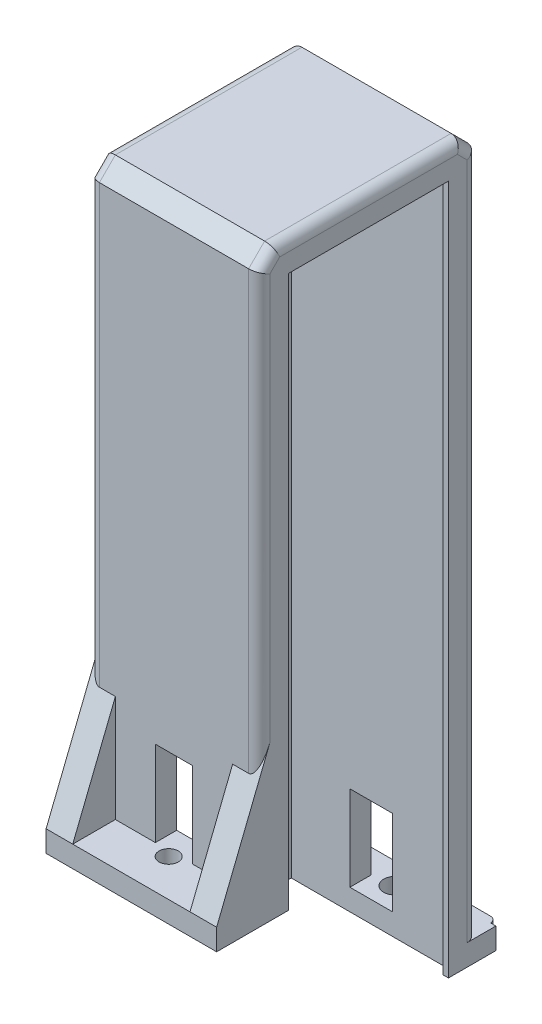
from build123d import *

# Parameters (mm, degrees)
SKETCH1_W            = 30
SKETCH1_H            = 105
BOSS_EXTRUDE1_DEPTH  = 4
SKETCH2_W            = 30
SKETCH2_H            = 12
SKETCH2_R            = 1.8
BOSS_EXTRUDE2_DEPTH  = 4
SKETCH3_W            = 7
SKETCH3_H            = 16
CUT_EXTRUDE1_DEPTH   = 110.494292089
BOSS_EXTRUDE3_DEPTH  = 4
BOSS_EXTRUDE4_START  = -30
BOSS_EXTRUDE4_DEPTH  = 4
SKETCH5_W            = 30
SKETCH5_H            = 41
BOSS_EXTRUDE5_DEPTH  = 4
SKETCH6_W            = 30
SKETCH6_H            = 135
BOSS_EXTRUDE6_DEPTH  = 4
SKETCH7_W            = 30
SKETCH7_H            = 8.5
BOSS_EXTRUDE7_DEPTH  = 4
FILLET1_R            = 1.1
SKETCH10_W           = 2.15
SKETCH10_H           = 4
SKETCH11_W           = 8
SKETCH11_H           = 8.5
CUT_EXTRUDE2_DEPTH   = 16
SKETCH14_W           = 1.8
SKETCH14_H           = 30
BOSS_EXTRUDE8_DEPTH  = 1
SKETCH16_W           = 3.4
SKETCH16_H           = 4
BOSS_EXTRUDE10_DEPTH = 1
BOSS_EXTRUDE9_START  = -30
BOSS_EXTRUDE9_DEPTH  = 1
SKETCH17_W           = 3.4
SKETCH17_H           = 4
BOSS_EXTRUDE11_DEPTH = 1
CHAMFER1_SIZE        = 3
FILLET2_R            = 2


with BuildPart() as part:
    # Sketch1 → Boss-Extrude1 (new body)
    with BuildSketch(Plane.XY):
        with Locations((15, 52.5)):
            Rectangle(SKETCH1_W, SKETCH1_H)
    extrude(amount=BOSS_EXTRUDE1_DEPTH)

    # Sketch2 → Boss-Extrude2 (add)
    with BuildSketch(Plane.XZ):
        with Locations((15, 6)):
            Rectangle(SKETCH2_W, SKETCH2_H)
        with Locations((15, 5)):
            Circle(SKETCH2_R, mode=Mode.SUBTRACT)
    extrude(amount=-BOSS_EXTRUDE2_DEPTH)

    # Sketch3 → Cut-Extrude1 (cut, through all)
    with BuildSketch(Plane.XY.offset(4)):
        with Locations((15, 12)):
            Rectangle(SKETCH3_W, SKETCH3_H)
    extrude(amount=-CUT_EXTRUDE1_DEPTH, mode=Mode.SUBTRACT)

    # Sketch4 → Boss-Extrude3 (add)
    with BuildSketch(Plane.ZY):
        Polygon((12, 4), (0, 34), (0, 4), align=None)
    extrude(amount=-BOSS_EXTRUDE3_DEPTH)

    # Sketch4<2> → Boss-Extrude4 (add)
    with BuildSketch(Plane.ZY.offset(BOSS_EXTRUDE4_START)):
        Polygon((12, 4), (0, 34), (0, 4), align=None)
    extrude(amount=BOSS_EXTRUDE4_DEPTH)

    # Sketch5 → Boss-Extrude5 (add)
    with BuildSketch(Plane(origin=(0, 105, 0), x_dir=(1, 0, 0), z_dir=(0, 1, 0))):
        with Locations((15, 16.5)):
            Rectangle(SKETCH5_W, SKETCH5_H)
    extrude(amount=BOSS_EXTRUDE5_DEPTH)

    # Sketch6 → Boss-Extrude6 (add)
    with BuildSketch(Plane(origin=(0, 0, -37), x_dir=(-1, 0, 0), z_dir=(0, 0, -1))):
        with Locations((-15, 41.5)):
            Rectangle(SKETCH6_W, SKETCH6_H)
    extrude(amount=-BOSS_EXTRUDE6_DEPTH)

    # Sketch7 → Boss-Extrude7 (add)
    with BuildSketch(Plane.XZ.offset(26)):
        with Locations((15, -37.25)):
            Rectangle(SKETCH7_W, SKETCH7_H)
    extrude(amount=-BOSS_EXTRUDE7_DEPTH)

    # Fillet1
    fillet1_edges = [part.edges().sort_by_distance(p)[0] for p in [
        (0, -24, -41.5),
        (30, -24, -41.5),
    ]]
    fillet(fillet1_edges, radius=FILLET1_R)

    # Sketch10 → Ø4.3 (4.3) Diameter Hole1 (revolve, cut)
    with BuildSketch(Plane(origin=(15, -22, -37.5), x_dir=(0, 0, 1), z_dir=(1, 0, 0))):
        with Locations((1.075, 2)):
            Rectangle(SKETCH10_W, SKETCH10_H)
    revolve(axis=Axis((15, -15.65, -37.5), (0, -1, 0)), mode=Mode.SUBTRACT)

    # Sketch11 → Cut-Extrude2 (cut)
    with BuildSketch(Plane(origin=(0, -22, 0), x_dir=(1, 0, 0), z_dir=(0, 1, 0))):
        with Locations((15, 37.25)):
            Rectangle(SKETCH11_W, SKETCH11_H)
    extrude(amount=CUT_EXTRUDE2_DEPTH, mode=Mode.SUBTRACT)

    # Sketch14 → Ø3.6 (3.6) Diameter Hole1 (revolve, cut)
    with BuildSketch(Plane(origin=(15, 4, 5), x_dir=(0, 0, 1), z_dir=(1, 0, 0))):
        with Locations((0.9, 15)):
            Rectangle(SKETCH14_W, SKETCH14_H)
    revolve(axis=Axis((15, 10.35, 5), (0, -1, 0)), mode=Mode.SUBTRACT)

    # Sketch15 → Boss-Extrude8 (add)
    with BuildSketch(Plane.ZY):
        Polygon((-37, 109), (4, 109), (4, 0), (-1.5, 0), (-1.5, 103.5), (-31.5, 103.5), (-31.5, -26), (-37, -26), align=None)
    extrude(amount=BOSS_EXTRUDE8_DEPTH)

    # Sketch16 → Boss-Extrude10 (add)
    with BuildSketch(Plane.ZY):
        Polygon((4, 24), (4, 0), (12, 0), (12, 4), align=None)
        with Locations((-38.7, -24)):
            Rectangle(SKETCH16_W, SKETCH16_H)
    extrude(amount=BOSS_EXTRUDE10_DEPTH)

    # Sketch15<2> → Boss-Extrude9 (add)
    with BuildSketch(Plane.ZY.offset(BOSS_EXTRUDE9_START)):
        Polygon((-37, 109), (4, 109), (4, 0), (-1.5, 0), (-1.5, 103.5), (-31.5, 103.5), (-31.5, -26), (-37, -26), align=None)
    extrude(amount=-BOSS_EXTRUDE9_DEPTH)

    # Sketch17 → Boss-Extrude11 (add)
    with BuildSketch(Plane(origin=(30, 0, 0), x_dir=(0, 0, -1), z_dir=(1, 0, 0))):
        Polygon((-12, 0), (-4, 0), (-4, 24), (-12, 4), align=None)
        with Locations((38.7, -24)):
            Rectangle(SKETCH17_W, SKETCH17_H)
    extrude(amount=BOSS_EXTRUDE11_DEPTH)

    # Chamfer1
    chamfer1_edges = [part.edges().sort_by_distance(p)[0] for p in [
        (15, 109, 4),
        (15, 109, -37),
    ]]
    chamfer(chamfer1_edges, length=CHAMFER1_SIZE)

    # Fillet2
    # the kernel refuses this fillet: 2 mm, written as the material it takes off along each edge
    with BuildSketch(Plane(origin=(-1, 111, 4), x_dir=(1, 0, 0), z_dir=(0, -1, 0))) as fillet2_piece_1_section:
        with BuildLine():
            CenterArc((FILLET2_R, -FILLET2_R), FILLET2_R, 90, 90)
            Line((0, -FILLET2_R), (0, 0))
            Line((0, 0), (FILLET2_R, 0))
        make_face()
    fillet2_piece_1 = extrude(amount=92, mode=Mode.PRIVATE)
    fillet2_piece_1 = split(fillet2_piece_1, bisect_by=Plane(origin=(-0.544012224, 62.136356158, -11.254542463), z_dir=(0, 0.3713906763541038, 0.9284766908852594)), keep=Keep.TOP, mode=Mode.PRIVATE)
    add(fillet2_piece_1, mode=Mode.SUBTRACT)
    with BuildSketch(Plane(origin=(31, 111, 4), x_dir=(-1, 0, 0), z_dir=(0, -1, 0))) as fillet2_piece_2_section:
        with BuildLine():
            CenterArc((FILLET2_R, FILLET2_R), FILLET2_R, 180, 90)
            Line((0, FILLET2_R), (0, 0))
            Line((0, 0), (FILLET2_R, 0))
        make_face()
    fillet2_piece_2 = extrude(amount=92, mode=Mode.PRIVATE)
    fillet2_piece_2 = split(fillet2_piece_2, bisect_by=Plane(origin=(30.544012224, 62.136356158, -11.254542463), z_dir=(0, 0.37139067635410367, 0.9284766908852594)), keep=Keep.TOP, mode=Mode.PRIVATE)
    add(fillet2_piece_2, mode=Mode.SUBTRACT)
    with BuildSketch(Plane(origin=(-1, 109, -39), x_dir=(0, -1, 0), z_dir=(0, 0, 1))) as fillet2_piece_3:
        with BuildLine():
            CenterArc((FILLET2_R, FILLET2_R), FILLET2_R, 180, 90)
            Line((0, FILLET2_R), (0, 0))
            Line((0, 0), (FILLET2_R, 0))
        make_face()
    extrude(amount=45, mode=Mode.SUBTRACT)
    with BuildSketch(Plane(origin=(31, 109, -39), x_dir=(0, -1, 0), z_dir=(0, 0, 1))) as fillet2_piece_4:
        with BuildLine():
            CenterArc((FILLET2_R, -FILLET2_R), FILLET2_R, 90, 90)
            Line((0, -FILLET2_R), (0, 0))
            Line((0, 0), (FILLET2_R, 0))
        make_face()
    extrude(amount=45, mode=Mode.SUBTRACT)
    with BuildSketch(Plane(origin=(-1, -22, -37), x_dir=(0, 0, 1), z_dir=(0, 1, 0))) as fillet2_piece_5:
        with BuildLine():
            CenterArc((FILLET2_R, FILLET2_R), FILLET2_R, 180, 90)
            Line((0, FILLET2_R), (0, 0))
            Line((0, 0), (FILLET2_R, 0))
        make_face()
    extrude(amount=133, mode=Mode.SUBTRACT)
    with BuildSketch(Plane(origin=(-1, 102.464466094, 7.535533906), x_dir=(0, -0.7071067811865476, -0.7071067811865476), z_dir=(0, 0.7071067811865476, -0.7071067811865476)), Plane(origin=(-1, 112.535533906, -30.464466094), x_dir=(0, -0.7071067811865476, 0.7071067811865476), z_dir=(0, -0.7071067811865476, -0.7071067811865476)), Plane(origin=(31, 102.464466094, 7.535533906), x_dir=(-1, 0, 0), z_dir=(0, 0.7071067811865476, -0.7071067811865476))) as fillet2_piece_6:
        with BuildLine():
            CenterArc((FILLET2_R, -FILLET2_R), FILLET2_R, 90, 90)
            Line((0, -FILLET2_R), (0, 0))
            Line((0, 0), (FILLET2_R, 0))
        make_face()
    extrude(amount=14.242640687, mode=Mode.SUBTRACT)
    with BuildSketch(Plane(origin=(31, -22, -37), x_dir=(0, 0, 1), z_dir=(0, 1, 0))) as fillet2_piece_7:
        with BuildLine():
            CenterArc((FILLET2_R, -FILLET2_R), FILLET2_R, 90, 90)
            Line((0, -FILLET2_R), (0, 0))
            Line((0, 0), (FILLET2_R, 0))
        make_face()
    extrude(amount=133, mode=Mode.SUBTRACT)
    with BuildSketch(Plane(origin=(31, 112.535533906, -30.464466094), x_dir=(0, -0.7071067811865476, 0.7071067811865476), z_dir=(0, -0.7071067811865476, -0.7071067811865476))) as fillet2_piece_8:
        with BuildLine():
            CenterArc((FILLET2_R, FILLET2_R), FILLET2_R, 180, 90)
            Line((0, FILLET2_R), (0, 0))
            Line((0, 0), (FILLET2_R, 0))
        make_face()
    extrude(amount=14.242640687, mode=Mode.SUBTRACT)


solid = part.part
